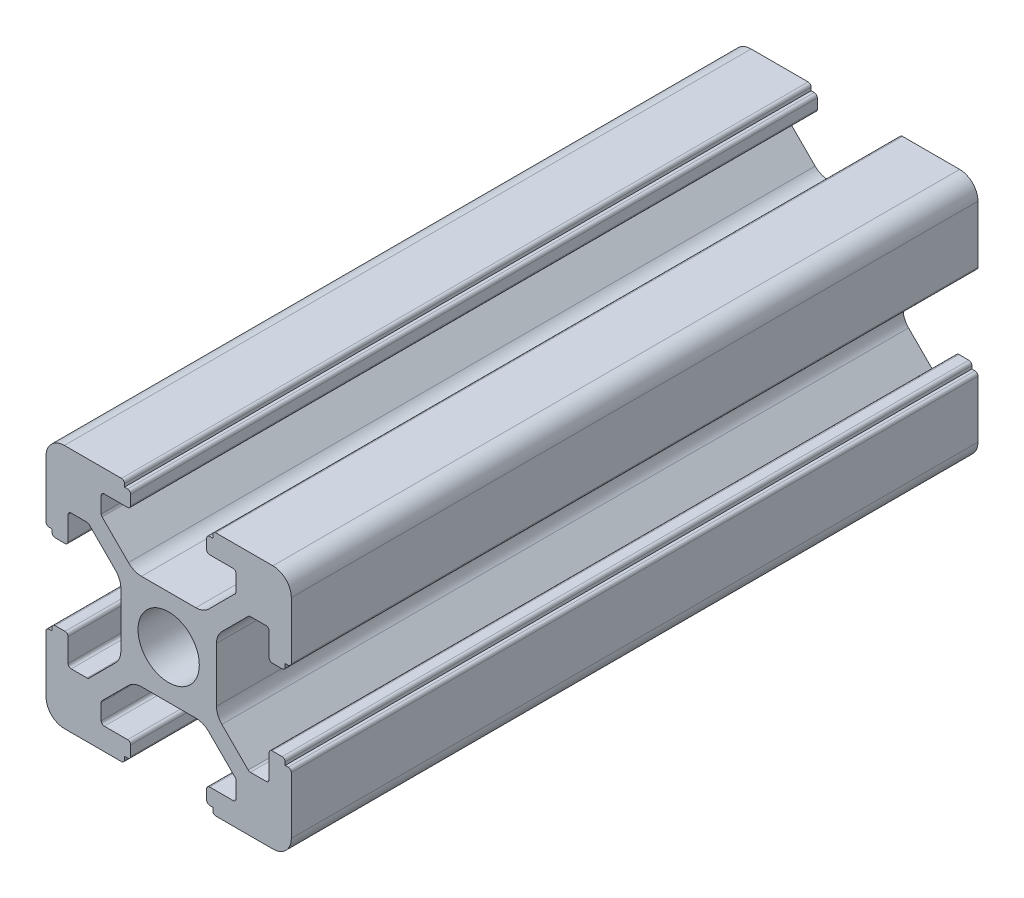
from build123d import *

# Parameters (mm, degrees)
SKETCH_1_R      = 2.5
EXTRUDE_1_DEPTH = 56


with BuildPart() as part:
    # 草图1 → 凸台-拉伸1 (new body)
    with BuildSketch(Plane.XY):
        with BuildLine():
            ThreePointArc((-10.002261885, -8.502261885), (-9.562922057, -9.562922057), (-8.502261885, -10.002261885))
            Line((-8.502261885, -10.002261885), (-3.85, -10.002261885))
            ThreePointArc((-3.85, -10.002261885), (-3.673223305, -9.929038581), (-3.6, -9.752261885))
            Line((-3.6, -9.752261885), (-3.6, -9.502261885))
            Line((-3.6, -9.502261885), (-3.35, -9.502261885))
            ThreePointArc((-3.35, -9.502261885), (-3.173223305, -9.429038581), (-3.1, -9.252261885))
            Line((-3.1, -9.252261885), (-3.1, -8.45))
            ThreePointArc((-3.1, -8.45), (-3.173223305, -8.273223305), (-3.35, -8.2))
            Line((-3.35, -8.2), (-5.25, -8.2))
            ThreePointArc((-5.25, -8.2), (-5.426776695, -8.126776695), (-5.5, -7.95))
            Line((-5.5, -7.95), (-5.5, -6.664213562))
            ThreePointArc((-5.5, -6.664213562), (-5.480969883, -6.568542704), (-5.426776695, -6.487436867))
            Line((-5.426776695, -6.487436867), (-3.278679656, -4.339339828))
            ThreePointArc((-3.278679656, -4.339339828), (-2.792044633, -4.014180701), (-2.218019485, -3.9))
            Line((-2.218019485, -3.9), (2.218019485, -3.9))
            ThreePointArc((2.218019485, -3.9), (2.792044633, -4.014180701), (3.278679656, -4.339339828))
            Line((3.278679656, -4.339339828), (5.426776695, -6.487436867))
            ThreePointArc((5.426776695, -6.487436867), (5.480969883, -6.568542704), (5.5, -6.664213562))
            Line((5.5, -6.664213562), (5.5, -7.95))
            ThreePointArc((5.5, -7.95), (5.426776695, -8.126776695), (5.25, -8.2))
            Line((5.25, -8.2), (3.35, -8.2))
            ThreePointArc((3.35, -8.2), (3.173223305, -8.273223305), (3.1, -8.45))
            Line((3.1, -8.45), (3.1, -9.252261885))
            ThreePointArc((3.1, -9.252261885), (3.173223305, -9.429038581), (3.35, -9.502261885))
            Line((3.35, -9.502261885), (3.6, -9.502261885))
            Line((3.6, -9.502261885), (3.6, -9.752261885))
            ThreePointArc((3.6, -9.752261885), (3.673223305, -9.929038581), (3.85, -10.002261885))
            Line((3.85, -10.002261885), (8.502261885, -10.002261885))
            ThreePointArc((8.502261885, -10.002261885), (9.562922057, -9.562922057), (10.002261885, -8.502261885))
            Line((10.002261885, -8.502261885), (10.002261885, -3.85))
            ThreePointArc((10.002261885, -3.85), (9.929038581, -3.673223305), (9.752261885, -3.6))
            Line((9.752261885, -3.6), (9.502261885, -3.6))
            Line((9.502261885, -3.6), (9.502261885, -3.35))
            ThreePointArc((9.502261885, -3.35), (9.429038581, -3.173223305), (9.252261885, -3.1))
            Line((9.252261885, -3.1), (8.45, -3.1))
            ThreePointArc((8.45, -3.1), (8.273223305, -3.173223305), (8.2, -3.35))
            Line((8.2, -3.35), (8.2, -5.25))
            ThreePointArc((8.2, -5.25), (8.126776695, -5.426776695), (7.95, -5.5))
            Line((7.95, -5.5), (6.664213562, -5.5))
            ThreePointArc((6.664213562, -5.5), (6.568542704, -5.480969883), (6.487436867, -5.426776695))
            Line((6.487436867, -5.426776695), (4.339339828, -3.278679656))
            ThreePointArc((4.339339828, -3.278679656), (4.014180701, -2.792044633), (3.9, -2.218019485))
            Line((3.9, -2.218019485), (3.9, 2.218019485))
            ThreePointArc((3.9, 2.218019485), (4.014180701, 2.792044633), (4.339339828, 3.278679656))
            Line((4.339339828, 3.278679656), (6.487436867, 5.426776695))
            ThreePointArc((6.487436867, 5.426776695), (6.568542704, 5.480969883), (6.664213562, 5.5))
            Line((6.664213562, 5.5), (7.95, 5.5))
            ThreePointArc((7.95, 5.5), (8.126776695, 5.426776695), (8.2, 5.25))
            Line((8.2, 5.25), (8.2, 3.35))
            ThreePointArc((8.2, 3.35), (8.273223305, 3.173223305), (8.45, 3.1))
            Line((8.45, 3.1), (9.252261885, 3.1))
            ThreePointArc((9.252261885, 3.1), (9.429038581, 3.173223305), (9.502261885, 3.35))
            Line((9.502261885, 3.35), (9.502261885, 3.6))
            Line((9.502261885, 3.6), (9.752261885, 3.6))
            ThreePointArc((9.752261885, 3.6), (9.929038581, 3.673223305), (10.002261885, 3.85))
            Line((10.002261885, 3.85), (10.002261885, 8.502261885))
            ThreePointArc((10.002261885, 8.502261885), (9.562922057, 9.562922057), (8.502261885, 10.002261885))
            Line((8.502261885, 10.002261885), (3.85, 10.002261885))
            ThreePointArc((3.85, 10.002261885), (3.673223305, 9.929038581), (3.6, 9.752261885))
            Line((3.6, 9.752261885), (3.6, 9.502261885))
            Line((3.6, 9.502261885), (3.35, 9.502261885))
            ThreePointArc((3.35, 9.502261885), (3.173223305, 9.429038581), (3.1, 9.252261885))
            Line((3.1, 9.252261885), (3.1, 8.45))
            ThreePointArc((3.1, 8.45), (3.173223305, 8.273223305), (3.35, 8.2))
            Line((3.35, 8.2), (5.25, 8.2))
            ThreePointArc((5.25, 8.2), (5.426776695, 8.126776695), (5.5, 7.95))
            Line((5.5, 7.95), (5.5, 6.664213562))
            ThreePointArc((5.5, 6.664213562), (5.480969883, 6.568542704), (5.426776695, 6.487436867))
            Line((5.426776695, 6.487436867), (3.278679656, 4.339339828))
            ThreePointArc((3.278679656, 4.339339828), (2.792044633, 4.014180701), (2.218019485, 3.9))
            Line((2.218019485, 3.9), (-2.218019485, 3.9))
            ThreePointArc((-2.218019485, 3.9), (-2.792044633, 4.014180701), (-3.278679656, 4.339339828))
            Line((-3.278679656, 4.339339828), (-5.426776695, 6.487436867))
            ThreePointArc((-5.426776695, 6.487436867), (-5.480969883, 6.568542704), (-5.5, 6.664213562))
            Line((-5.5, 6.664213562), (-5.5, 7.95))
            ThreePointArc((-5.5, 7.95), (-5.426776695, 8.126776695), (-5.25, 8.2))
            Line((-5.25, 8.2), (-3.35, 8.2))
            ThreePointArc((-3.35, 8.2), (-3.173223305, 8.273223305), (-3.1, 8.45))
            Line((-3.1, 8.45), (-3.1, 9.252261885))
            ThreePointArc((-3.1, 9.252261885), (-3.173223305, 9.429038581), (-3.35, 9.502261885))
            Line((-3.35, 9.502261885), (-3.6, 9.502261885))
            Line((-3.6, 9.502261885), (-3.6, 9.752261885))
            ThreePointArc((-3.6, 9.752261885), (-3.673223305, 9.929038581), (-3.85, 10.002261885))
            Line((-3.85, 10.002261885), (-8.502261885, 10.002261885))
            ThreePointArc((-8.502261885, 10.002261885), (-9.562922057, 9.562922057), (-10.002261885, 8.502261885))
            Line((-10.002261885, 8.502261885), (-10.002261885, 3.85))
            ThreePointArc((-10.002261885, 3.85), (-9.929038581, 3.673223305), (-9.752261885, 3.6))
            Line((-9.752261885, 3.6), (-9.502261885, 3.6))
            Line((-9.502261885, 3.6), (-9.502261885, 3.35))
            ThreePointArc((-9.502261885, 3.35), (-9.429038581, 3.173223305), (-9.252261885, 3.1))
            Line((-9.252261885, 3.1), (-8.45, 3.1))
            ThreePointArc((-8.45, 3.1), (-8.273223305, 3.173223305), (-8.2, 3.35))
            Line((-8.2, 3.35), (-8.2, 5.25))
            ThreePointArc((-8.2, 5.25), (-8.126776695, 5.426776695), (-7.95, 5.5))
            Line((-7.95, 5.5), (-6.664213562, 5.5))
            ThreePointArc((-6.664213562, 5.5), (-6.568542704, 5.480969883), (-6.487436867, 5.426776695))
            Line((-6.487436867, 5.426776695), (-4.339339828, 3.278679656))
            ThreePointArc((-4.339339828, 3.278679656), (-4.014180701, 2.792044633), (-3.9, 2.218019485))
            Line((-3.9, 2.218019485), (-3.9, -2.218019485))
            ThreePointArc((-3.9, -2.218019485), (-4.014180701, -2.792044633), (-4.339339828, -3.278679656))
            Line((-4.339339828, -3.278679656), (-6.487436867, -5.426776695))
            ThreePointArc((-6.487436867, -5.426776695), (-6.568542704, -5.480969883), (-6.664213562, -5.5))
            Line((-6.664213562, -5.5), (-7.95, -5.5))
            ThreePointArc((-7.95, -5.5), (-8.126776695, -5.426776695), (-8.2, -5.25))
            Line((-8.2, -5.25), (-8.2, -3.35))
            ThreePointArc((-8.2, -3.35), (-8.273223305, -3.173223305), (-8.45, -3.1))
            Line((-8.45, -3.1), (-9.252261885, -3.1))
            ThreePointArc((-9.252261885, -3.1), (-9.429038581, -3.173223305), (-9.502261885, -3.35))
            Line((-9.502261885, -3.35), (-9.502261885, -3.6))
            Line((-9.502261885, -3.6), (-9.752261885, -3.6))
            ThreePointArc((-9.752261885, -3.6), (-9.929038581, -3.673223305), (-10.002261885, -3.85))
            Line((-10.002261885, -3.85), (-10.002261885, -8.502261885))
        make_face()
        Circle(SKETCH_1_R, mode=Mode.SUBTRACT)
    extrude(amount=EXTRUDE_1_DEPTH)


solid = part.part
